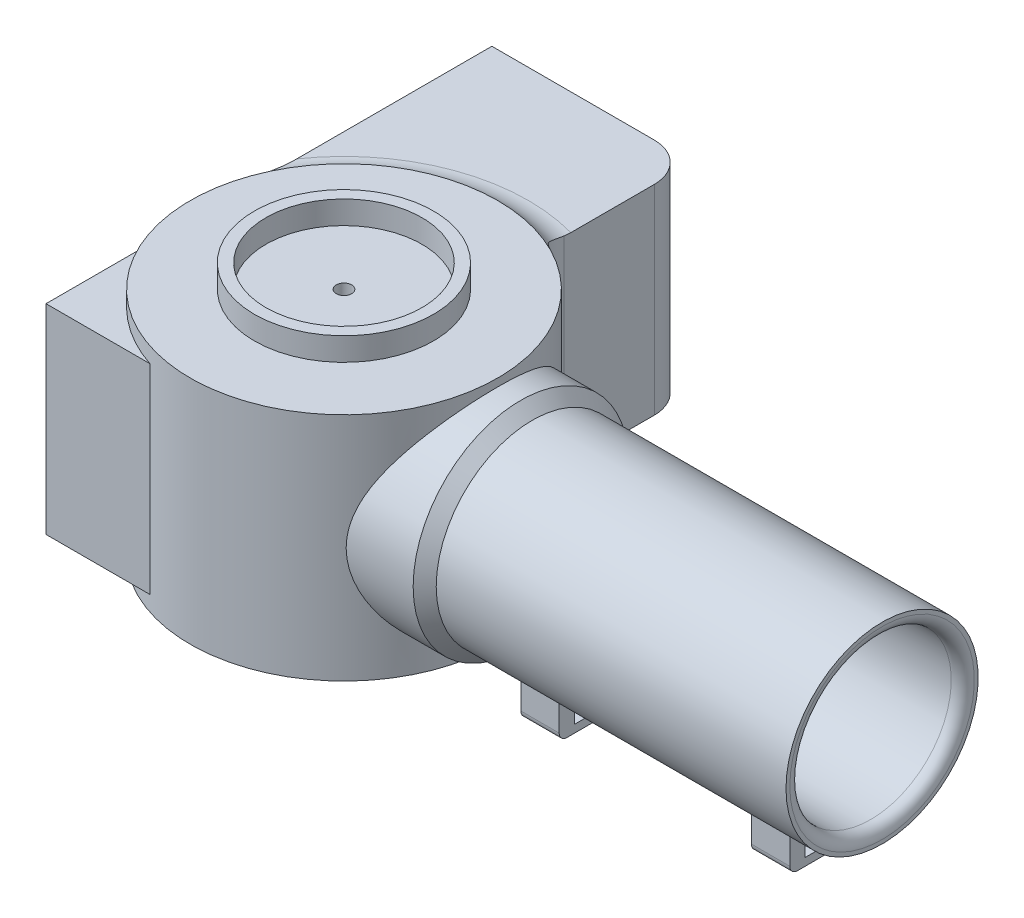
from build123d import *

# Parameters (mm, degrees)
SKETCH1_R                 = 20
BOSS_EXTRUDE1_DEPTH       = 30
SKETCH2_R                 = 12.5
BOSS_EXTRUDE2_DEPTH       = 90
SKETCH3_R                 = 14
BOSS_EXTRUDE3_DEPTH       = 25
CHAMFER1_SIZE             = 2
SKETCH5_R                 = 15
BOSS_EXTRUDE4_DEPTH       = 30
BOSS_EXTRUDE5_START       = -20
SKETCH6_R                 = 14
BOSS_EXTRUDE5_DEPTH       = 20
CHAMFER2_SIZE             = 2
SKETCH7_W                 = 73.124402067
SKETCH7_H                 = 39.340928312
CUT_EXTRUDE1_DEPTH        = 15
SHELL1_T                  = -2
SKETCH8_W                 = 56.380111569
SKETCH8_H                 = 26
CUT_EXTRUDE2_DEPTH        = 30
SKETCH9_W                 = 7.204718237
SKETCH9_H                 = 22
CUT_EXTRUDE3_DEPTH        = 4.87
SKETCH10_R                = 0.75
SKETCH10_W                = 41.4
SKETCH10_H                = 20.4
BOSS_EXTRUDE6_DEPTH       = 4.83
CUT_EXTRUDE4_REACH        = 97.126
SKETCH11_W                = 2.5
SKETCH11_H                = 3
SKETCH12_W                = 58
SKETCH12_H                = 26
SKETCH12_W_2              = 54.4
SKETCH12_H_2              = 22.4
BOSS_EXTRUDE7_DEPTH       = 24.62884
SKETCH13_W                = 21.60198206
SKETCH13_H                = 26
BOSS_EXTRUDE8_DEPTH       = 1.5
FILLET1_START             = 2
FILLET1_DEPTH             = 26
FILLET1_START_2           = -1.363e-06
FILLET1_2_DEPTH           = 2.000001363
FILLET1_START_3           = 28
FILLET1_3_DEPTH           = 2.0000001
FILLET1_4_DEPTH           = 26
FILLET1_5_ANGLE           = 108.145446
SKETCH15_R                = 11.65
SKETCH15_R_2              = 10.15
BOSS_EXTRUDE9_DEPTH       = 3
SKETCH16_R                = 1
CUT_EXTRUDE7_DEPTH        = 13
CUT_EXTRUDE8_START        = -28
SKETCH17_R                = 3
CUT_EXTRUDE8_DEPTH        = 28
FILLET2_R                 = 1.5
BOSS_EXTRUDE10_REACH      = 88.66
BOSS_EXTRUDE10_END_RADIUS = 12.5
SKETCH18_W                = 5
SKETCH18_H                = 14
SKETCH19_W                = 5
SKETCH19_H                = 14
BOSS_EXTRUDE11_DEPTH      = 5
CUT_EXTRUDE9_REACH        = 101.172
SKETCH21_W                = 10
SKETCH21_H                = 4
CUT_EXTRUDE11_DEPTH       = 5
FILLET3_R                 = 1


with BuildPart() as part:
    # Sketch1 → Boss-Extrude1 (new body)
    with BuildSketch(Plane(origin=(0, 0, 0), x_dir=(1, 0, 0), z_dir=(0, 1, 0))):
        with Locations(Location((0, 0, 0), (0, 0, 270))):
            Circle(SKETCH1_R)
    extrude(amount=BOSS_EXTRUDE1_DEPTH)

    # Sketch2 → Boss-Extrude2 (add)
    with BuildSketch(Plane(origin=(0, 0, 0), x_dir=(0, 0, -1), z_dir=(1, 0, 0))):
        with Locations(Location((0, 15, 0), (0, 0, 180))):
            Circle(SKETCH2_R)
    extrude(amount=BOSS_EXTRUDE2_DEPTH)

    # Sketch3 → Boss-Extrude3 (add)
    with BuildSketch(Plane(origin=(0, 0, 0), x_dir=(0, 0, -1), z_dir=(1, 0, 0))):
        with Locations(Location((0, 15, 0), (0, 0, 180))):
            Circle(SKETCH3_R)
    extrude(amount=BOSS_EXTRUDE3_DEPTH)

    # Chamfer1
    # the kernel refuses this chamfer: 2 mm, written as the material it takes off along each edge
    with BuildSketch(Plane(origin=(25, 15, 0), x_dir=(0, 0, 1), z_dir=(0, 1, 0))) as chamfer1_piece_1_section:
        Polygon((14, -CHAMFER1_SIZE), (14 - CHAMFER1_SIZE, 0), (14, 0), align=None)
    chamfer1_piece_1 = revolve(axis=Axis((25, 15, 0), (1, 0, 0)), mode=Mode.PRIVATE)
    chamfer1_piece_1 = chamfer1_piece_1 - Plane(origin=(25, 15, 0), x_dir=(0, 0, 1), z_dir=(-1, 0, 0)) * Cylinder(12.5, 56, mode=Mode.PRIVATE)
    add(chamfer1_piece_1, mode=Mode.SUBTRACT)

    # Sketch5 → Boss-Extrude4 (add)
    with BuildSketch(Plane(origin=(0, 0, 0), x_dir=(1, 0, 0), z_dir=(0, 1, 0))):
        with Locations(Location((98.291561976, 0, 0), (0, 0, 270))):
            Circle(SKETCH5_R)
    extrude(amount=BOSS_EXTRUDE4_DEPTH)

    # Sketch6 → Boss-Extrude5 (add)
    with BuildSketch(Plane(origin=(98.29, 0, 0), x_dir=(0, 0, -1), z_dir=(1, 0, 0)).offset(BOSS_EXTRUDE5_START)):
        with Locations(Location((0, 15, 0), (0, 0, 180))):
            Circle(SKETCH6_R)
    extrude(amount=BOSS_EXTRUDE5_DEPTH)

    # Chamfer2
    # the kernel refuses this chamfer: 2 mm, written as the material it takes off along each edge
    with BuildSketch(Plane(origin=(78.29, 15, 0), x_dir=(0, 0, 1), z_dir=(0, 1, 0))) as chamfer2_piece_1_section:
        Polygon((14 - CHAMFER2_SIZE, 0), (14, CHAMFER2_SIZE), (14, 0), align=None)
    chamfer2_piece_1 = revolve(axis=Axis((78.29, 15, 0), (1, 0, 0)), mode=Mode.PRIVATE)
    chamfer2_piece_1 = chamfer2_piece_1 - Plane(origin=(78.29, 15, 0), x_dir=(0, 0, 1), z_dir=(-1, 0, 0)) * Cylinder(12.5, 57, mode=Mode.PRIVATE)
    add(chamfer2_piece_1, mode=Mode.SUBTRACT)

    # Sketch7 → Cut-Extrude1 (cut, symmetric)
    with BuildSketch(Plane.XY):
        with Locations((106.562201034, 14.522122295)):
            Rectangle(SKETCH7_W, SKETCH7_H)
    extrude(amount=CUT_EXTRUDE1_DEPTH, both=True, mode=Mode.SUBTRACT)

    # Shell1
    shell1_openings = [part.faces().sort_by_distance(p)[0] for p in [
        (70, 15, 0),
    ]]
    offset(amount=SHELL1_T, openings=shell1_openings, kind=Kind.INTERSECTION)

    # Sketch8 → Cut-Extrude2 (cut)
    with BuildSketch(Plane(origin=(0, 0, 0), x_dir=(0, 0, -1), z_dir=(1, 0, 0))):
        with Locations((11.190055785, 15)):
            Rectangle(SKETCH8_W, SKETCH8_H)
    extrude(amount=-CUT_EXTRUDE2_DEPTH, mode=Mode.SUBTRACT)

    # Sketch9 → Cut-Extrude3 (cut)
    with BuildSketch(Plane.ZY):
        with Locations((-19.098093975, 15)):
            Rectangle(SKETCH9_W, SKETCH9_H)
    extrude(amount=-CUT_EXTRUDE3_DEPTH, mode=Mode.SUBTRACT)

    # Sketch10 → Boss-Extrude6 (add)
    with BuildSketch(Plane.ZY):
        Polygon((-37, 2), (18, 2), (18, 4.5), (18, 25.5), (18, 28), (-37, 28), (-37, 25.5), (-37, 4.5), align=None)
        with Locations((14, 20)):
            Circle(SKETCH10_R, mode=Mode.SUBTRACT)
        with Locations(Location((14, 10, 0), (0, 0, 180))):
            Circle(SKETCH10_R, mode=Mode.SUBTRACT)
        with Locations((-34, 10)):
            Circle(SKETCH10_R, mode=Mode.SUBTRACT)
        with Locations(Location((-34, 20, 0), (0, 0, 180))):
            Circle(SKETCH10_R, mode=Mode.SUBTRACT)
        with Locations((-9.5, 15)):
            Rectangle(SKETCH10_W, SKETCH10_H, mode=Mode.SUBTRACT)
    extrude(amount=BOSS_EXTRUDE6_DEPTH)

    # Cut-Extrude4: up to this face of the body (flat: up to its plane)
    cut_extrude4_end = Plane(part.part.faces().sort_by_distance((-8.225866768, 15, 17))[0])
    # Sketch11 → Cut-Extrude4 (cut, up to the picked face)
    with BuildSketch(Plane(origin=(0, 0, -37), x_dir=(-1, 0, 0), z_dir=(0, 0, -1)), mode=Mode.PRIVATE) as cut_extrude4_sk1:
        with Locations((3.58, 15)):
            Rectangle(SKETCH11_W, SKETCH11_H)
    cut_extrude4_tool1 = split(extrude(cut_extrude4_sk1.sketch, amount=-CUT_EXTRUDE4_REACH, mode=Mode.PRIVATE), bisect_by=cut_extrude4_end, keep=Keep.BOTH, mode=Mode.PRIVATE)
    add(cut_extrude4_tool1.solids().sort_by(Axis((-3.58, 15, -37), (0, 0, 1)))[0], mode=Mode.SUBTRACT)

    # Sketch12 → Boss-Extrude7 (add)
    with BuildSketch(Plane.ZY.offset(-4.87)):
        with Locations((-10, 15)):
            Rectangle(SKETCH12_W, SKETCH12_H)
        with Locations((-10, 15)):
            Rectangle(SKETCH12_W_2, SKETCH12_H_2, mode=Mode.SUBTRACT)
    extrude(amount=BOSS_EXTRUDE7_DEPTH)

    # Sketch13 → Boss-Extrude8 (add)
    with BuildSketch(Plane(origin=(4.87, 0, 0), x_dir=(0, 0, -1), z_dir=(1, 0, 0))):
        with Locations((28.19900897, 15)):
            Rectangle(SKETCH13_W, SKETCH13_H)
    extrude(amount=BOSS_EXTRUDE8_DEPTH)

    # Fillet1: read off the stored shape, not the designer's step
    # Fillet1 outline → Fillet1 (cut)
    with BuildSketch(Plane(origin=(0, 0, 0), x_dir=(1, 0, 0), z_dir=(0, 1, 0)).offset(FILLET1_START)):
        with BuildLine():
            Line((6.37, 39), (1.37, 39))
            ThreePointArc((1.37, 39), (4.905533906, 37.535533906), (6.37, 34))
            Line((6.37, 34), (6.37, 39))
        make_face()
    extrude(amount=FILLET1_DEPTH, mode=Mode.SUBTRACT)

    # Fillet1 2 outline → Fillet1 2 (add)
    with BuildSketch(Plane(origin=(0, 0, 0), x_dir=(1, 0, 0), z_dir=(0, 1, 0)).offset(FILLET1_START_2)):
        with BuildLine():
            Line((1.37, 39), (-19.758839619, 39))
            Line((-19.758839619, 39), (-19.758839619, 3.096491064))
            ThreePointArc((-19.758839619, 3.096491064), (-9.086233883, 17.816855891), (9.096, 17.811871996))
            ThreePointArc((9.096, 17.811871996), (7.105612588, 19.654284498), (6.37, 22.264839995))
            Line((6.37, 22.264839995), (6.37, 34))
            ThreePointArc((6.37, 34), (4.905533906, 37.535533906), (1.37, 39))
        make_face()
    extrude(amount=FILLET1_2_DEPTH)

    # Fillet1 3 outline → Fillet1 3 (add)
    with BuildSketch(Plane(origin=(0, 0, 0), x_dir=(1, 0, 0), z_dir=(0, 1, 0)).offset(FILLET1_START_3)):
        with BuildLine():
            Line((1.37, 39), (-19.758839619, 39))
            Line((-19.758839619, 39), (-19.758839619, 3.096491064))
            ThreePointArc((-19.758839619, 3.096491064), (-9.086233883, 17.816855891), (9.096, 17.811871996))
            ThreePointArc((9.096, 17.811871996), (7.105612588, 19.654284498), (6.37, 22.264839995))
            Line((6.37, 22.264839995), (6.37, 34))
            ThreePointArc((6.37, 34), (4.905533906, 37.535533906), (1.37, 39))
        make_face()
    extrude(amount=FILLET1_3_DEPTH)

    # Fillet1 4 outline → Fillet1 4 (add)
    with BuildSketch(Plane(origin=(0, 0, 0), x_dir=(1, 0, 0), z_dir=(0, 1, 0)).offset(FILLET1_START)):
        with BuildLine():
            Line((6.37, 22.264839995), (6.37, 18.958457216))
            ThreePointArc((6.37, 18.958457216), (7.754221651, 18.435618964), (9.096, 17.811871996))
            ThreePointArc((9.096, 17.811871996), (7.105612588, 19.654284498), (6.37, 22.264839995))
        make_face()
    extrude(amount=FILLET1_4_DEPTH)

    # Fillet1 5 outline → Fillet1 5 (revolve, cut)
    with BuildSketch(Plane(origin=(0, 0, 0), x_dir=(0.4547999999999995, 0, -0.8905935997973489), z_dir=(0.8905935997973489, 0, 0.4547999999999995))):
        with BuildLine():
            ThreePointArc((19.999986597, 30.000017871), (21.763922032, 28.52786904), (24, 28))
            Line((24, 28), (43.719695139, 28))
            Line((43.719695139, 28), (43.719695139, 30.000017871))
            Line((43.719695139, 30.000017871), (19.999986597, 30.000017871))
        make_face()
        with BuildLine():
            Line((43.719695139, -2.1428e-05), (43.719695139, 2))
            Line((43.719695139, 2), (24, 2))
            ThreePointArc((24, 2), (21.763920044, 1.472129966), (19.999983929, -2.1428e-05))
            Line((19.999983929, -2.1428e-05), (43.719695139, -2.1428e-05))
        make_face()
    revolve(axis=Axis((0, 0, 0), (0, 1, 0)), revolution_arc=FILLET1_5_ANGLE, mode=Mode.SUBTRACT)

    # Sketch15 → Boss-Extrude9 (add)
    with BuildSketch(Plane(origin=(0, 30, 0), x_dir=(1, 0, 0), z_dir=(0, 1, 0))):
        with Locations(Location((0, 0, 0), (0, 0, 270))):
            Circle(SKETCH15_R)
        with Locations(Location((0, 0, 0), (0, 0, 270))):
            Circle(SKETCH15_R_2, mode=Mode.SUBTRACT)
    extrude(amount=BOSS_EXTRUDE9_DEPTH)

    # Sketch16 → Cut-Extrude7 (cut)
    with BuildSketch(Plane(origin=(0, 30, 0), x_dir=(1, 0, 0), z_dir=(0, 1, 0))):
        with Locations(Location((0, 0, 0), (0, 0, 270))):
            Circle(SKETCH16_R)
    extrude(amount=-CUT_EXTRUDE7_DEPTH, mode=Mode.SUBTRACT)

    # Sketch17 → Cut-Extrude8 (cut)
    with BuildSketch(Plane.XZ.offset(CUT_EXTRUDE8_START)):
        with Locations(Location((0, 0, 0), (0, 0, 90))):
            Circle(SKETCH17_R)
    extrude(amount=CUT_EXTRUDE8_DEPTH, mode=Mode.SUBTRACT)

    # Fillet2
    fillet2_edges = [part.edges().sort_by_distance(p)[0] for p in [
        (70, 15, -10.5),
    ]]
    fillet(fillet2_edges, radius=FILLET2_R)

    # Boss-Extrude10: up to this cylinder (the profile starts outside it)
    boss_extrude10_end = Plane(origin=(47.5, 15, 0), z_dir=(-1, 0, 0)) * Cylinder(BOSS_EXTRUDE10_END_RADIUS, 233.32, mode=Mode.PRIVATE)
    # Sketch18 → Boss-Extrude10 (add, up to the surface)
    with BuildSketch(Plane(origin=(0, 0, 0), x_dir=(1, 0, 0), z_dir=(0, 1, 0)), mode=Mode.PRIVATE) as boss_extrude10_sk1:
        with Locations((62.5, 0)):
            Rectangle(SKETCH18_W, SKETCH18_H)
    boss_extrude10_tool1 = extrude(boss_extrude10_sk1.sketch, amount=BOSS_EXTRUDE10_REACH, mode=Mode.PRIVATE) - boss_extrude10_end
    add(boss_extrude10_tool1.solids().sort_by_distance((62.5, 0, 0))[0])
    # Sketch18 → Boss-Extrude10 (add, up to the surface)
    with BuildSketch(Plane(origin=(0, 0, 0), x_dir=(1, 0, 0), z_dir=(0, 1, 0)), mode=Mode.PRIVATE) as boss_extrude10_sk2:
        with Locations((32.5, 0)):
            Rectangle(SKETCH18_W, SKETCH18_H)
    boss_extrude10_tool2 = extrude(boss_extrude10_sk2.sketch, amount=BOSS_EXTRUDE10_REACH, mode=Mode.PRIVATE) - boss_extrude10_end
    add(boss_extrude10_tool2.solids().sort_by_distance((32.5, 0, 0))[0])

    # Sketch19 → Boss-Extrude11 (add)
    with BuildSketch(Plane.XZ):
        with Locations((-8.804710266, 0)):
            Rectangle(SKETCH19_W, SKETCH19_H)
    extrude(amount=BOSS_EXTRUDE11_DEPTH)

    # Cut-Extrude9: up to this face of the body (flat: up to its plane)
    cut_extrude9_end = Plane(part.part.faces().sort_by_distance((30, 1.656320509, 0))[0])
    # Sketch20 → Cut-Extrude9 (cut, up to the picked face)
    with BuildSketch(Plane(origin=(65, 0, 0), x_dir=(0, 0, -1), z_dir=(1, 0, 0)), mode=Mode.PRIVATE) as cut_extrude9_sk1:
        with BuildLine():
            Line((5, 3.543560763), (5, 1))
            Line((5, 1), (-5, 1))
            Line((-5, 1), (-5, 3.543560763))
            ThreePointArc((-5, 3.543560763), (0, 2.5), (5, 3.543560763))
        make_face()
    cut_extrude9_tool1 = split(extrude(cut_extrude9_sk1.sketch, amount=-CUT_EXTRUDE9_REACH, mode=Mode.PRIVATE), bisect_by=cut_extrude9_end, keep=Keep.BOTH, mode=Mode.PRIVATE)
    add(cut_extrude9_tool1.solids().sort_by(Axis((65, 1.946857, 0), (-1, 0, 0)))[0], mode=Mode.SUBTRACT)

    # Sketch21 → Cut-Extrude11 (cut)
    with BuildSketch(Plane.ZY.offset(11.304710266)):
        with Locations((0, -2)):
            Rectangle(SKETCH21_W, SKETCH21_H)
    extrude(amount=-CUT_EXTRUDE11_DEPTH, mode=Mode.SUBTRACT)

    # Fillet3
    fillet3_edges = [part.edges().sort_by_distance(p)[0] for p in [
        (62.5, 0, -7),
        (62.5, 0, 7),
        (32.5, 0, -7),
        (32.5, 0, 7),
        (-8.804710266, -5, 7),
        (-8.804710266, -5, -7),
    ]]
    fillet(fillet3_edges, radius=FILLET3_R)


solid = part.part
